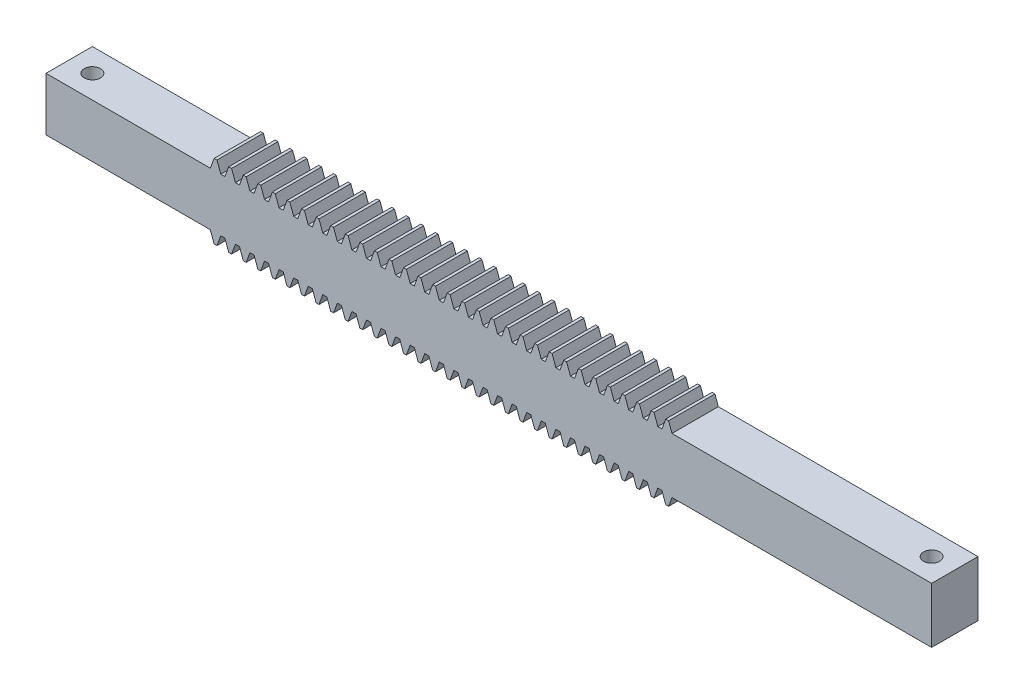
from build123d import *

# Parameters (mm, degrees)
BLANKSKE_W          = 100
BLANKSKE_H          = 8.5
BLANK_DEPTH         = 10
TOOTHCUTSIM_DEPTH   = 101.857572844
TEETHCUTS_COUNT     = 33
TEETHCUTS_PITCH     = 3.14159265
SKETCH1_W           = 10
SKETCH1_H           = 6.487737656
BOSS_EXTRUDE1_DEPTH = 56
SKETCH2_W           = 10
SKETCH2_H           = 6.25
BOSS_EXTRUDE2_DEPTH = 35
SKETCH3_R           = 1.75
CUT_EXTRUDE1_DEPTH  = 157.445078222
SKETCH4_R           = 1.75
CUT_EXTRUDE2_DEPTH  = 157.454756207
SKETCH5_W           = 191
SKETCH5_H           = 0.5
CUT_EXTRUDE3_DEPTH  = 157.551109865


# Read off the part's stored shape, not the designer's step: Mirror2
with BuildPart() as part:
    # BlankSke → Blank (new body)
    with BuildSketch(Plane.XY):
        with Locations((50, 4.25)):
            Rectangle(BLANKSKE_W, BLANKSKE_H)
    extrude(amount=-BLANK_DEPTH)

    # TooCutSkeSim → ToothCutSim (cut, through all)
    with BuildSketch(Plane.XY):
        Polygon((0.44443537, 6.25), (-0.44443537, 6.25), (-1.272613241, 8.5254), (1.272613241, 8.5254), align=None)
    toothcutsim = extrude(amount=-TOOTHCUTSIM_DEPTH, mode=Mode.SUBTRACT)

    # TeethCuts: ToothCutSim ×33
    with Locations(*[(i * TEETHCUTS_PITCH, 0, 0) for i in range(1, TEETHCUTS_COUNT)]):
        add(toothcutsim, mode=Mode.SUBTRACT)

    # Sketch1 → Boss-Extrude1 (add)
    with BuildSketch(Plane(origin=(100, 0, 0), x_dir=(0, 0, -1), z_dir=(1, 0, 0))):
        with Locations((5, 3.243868828)):
            Rectangle(SKETCH1_W, SKETCH1_H)
    extrude(amount=BOSS_EXTRUDE1_DEPTH)

    # Sketch2 → Boss-Extrude2 (add)
    with BuildSketch(Plane.ZY):
        with Locations((-5, 3.125)):
            Rectangle(SKETCH2_W, SKETCH2_H)
    extrude(amount=BOSS_EXTRUDE2_DEPTH)

    # Sketch3 → Cut-Extrude1 (cut, symmetric)
    with BuildSketch(Plane(origin=(0, 6.25, 0), x_dir=(1, 0, 0), z_dir=(0, 1, 0))):
        with Locations(Location((-30, 5, 0), (0, 0, 270))):
            Circle(SKETCH3_R)
    extrude(amount=CUT_EXTRUDE1_DEPTH, both=True, mode=Mode.SUBTRACT)

    # Sketch4 → Cut-Extrude2 (cut, through all)
    with BuildSketch(Plane(origin=(0, 6.487737656, 0), x_dir=(1, 0, 0), z_dir=(0, 1, 0))):
        with Locations(Location((151, 5, 0), (0, 0, 270))):
            Circle(SKETCH4_R)
    extrude(amount=-CUT_EXTRUDE2_DEPTH, mode=Mode.SUBTRACT)

    # Sketch5 → Cut-Extrude3 (cut, through all)
    with BuildSketch(Plane.XY):
        with Locations((60.5, 0.25)):
            Rectangle(SKETCH5_W, SKETCH5_H)
    extrude(amount=-CUT_EXTRUDE3_DEPTH, mode=Mode.SUBTRACT)

    # Mirror2: part across plane


with BuildPart() as part_1:
    add(part.part)
    add(part.part.mirror(Plane(origin=(-35, 0.5, -10), x_dir=(0, 0, 1), z_dir=(0, 1, 0))))


solid = part_1.part
